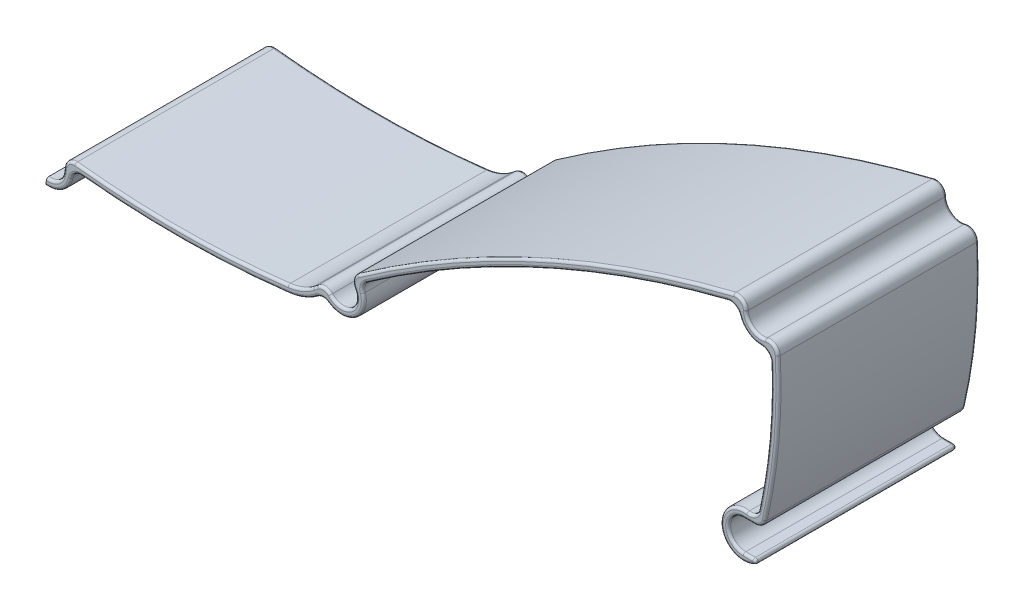
from build123d import *
from build123d.topology import SkipClean

# Parameters (mm, degrees)
EXTRUDE_1_DEPTH     = 40
SKETCH_2_R          = 3
EXTRUDE_1_2_DEPTH   = 40
EXTRUDE_2_DEPTH     = 40
CUT_EXTRUDE_2_DEPTH = 208.592060428
FILLET_1_R          = 2
FILLET_3_R          = 0.5
FILLET_4_R          = 0.5
CUT_EXTRUDE_3_DEPTH = 207.611727306


with BuildPart() as part:
    # ｽｹｯﾁ1 → Extrude 1 (new body)
    with BuildSketch(Plane.XY):
        with BuildLine():
            ThreePointArc((-174.917675812, 6.802025891), (-175.16536545, 24.049389715), (-168.029000204, 39.753058081))
            ThreePointArc((-168.029000204, 39.753058081), (-164.386404751, 43.234236237), (-159.829079223, 45.38316318))
            ThreePointArc((-159.829079223, 45.38316318), (-73.039152779, 60.834071576), (15.071759596, 58.061162838))
            ThreePointArc((15.071759596, 58.061162838), (38.698282136, 56.368912879), (62.348129133, 57.695945012))
            ThreePointArc((62.348129133, 57.695945012), (64.982359088, 58.386614212), (67.332573283, 59.762362967))
            ThreePointArc((67.332573283, 59.762362967), (68.437320119, 60.625078199), (69.547541148, 61.480737248))
            ThreePointArc((69.547541148, 61.480737248), (69.829795591, 61.819116287), (69.939206591, 62.245961901))
            ThreePointArc((69.939206591, 62.245961901), (71.148233251, 64.567309568), (73.719523874, 65.056047728))
            ThreePointArc((73.719523874, 65.056047728), (74.15979094, 65.03780341), (74.565156848, 65.21056459))
            ThreePointArc((74.565156848, 65.21056459), (113.346908434, 87.575280448), (155.853132865, 101.626104486))
            ThreePointArc((155.853132865, 101.626104486), (158.26218824, 101.124572816), (159.485666507, 98.989582711))
            ThreePointArc((159.485666507, 98.989582711), (159.562144442, 78.779630656), (155.859832877, 58.911543179))
            Line((155.859832877, 58.911543179), (154.417522154, 59.323538057))
            ThreePointArc((154.417522154, 59.323538057), (158.068245541, 78.914782698), (157.992833254, 98.843128361))
            ThreePointArc((157.992833254, 98.843128361), (157.38109412, 99.910623413), (156.176566433, 100.161389249))
            ThreePointArc((156.176566433, 100.161389249), (113.960157168, 86.206366284), (75.442826616, 63.994137124))
            ThreePointArc((75.442826616, 63.994137124), (74.429411845, 63.562234175), (73.32874418, 63.607844969))
            ThreePointArc((73.32874418, 63.607844969), (72.043098868, 63.363475889), (71.438585538, 62.202802056))
            ThreePointArc((71.438585538, 62.202802056), (71.165058039, 61.135688021), (70.459421932, 60.289740423))
            ThreePointArc((70.459421932, 60.289740423), (69.356770591, 59.439915413), (68.259556121, 58.583082331))
            ThreePointArc((68.259556121, 58.583082331), (65.556810089, 57.000971383), (62.527445976, 56.206701758))
            ThreePointArc((62.527445976, 56.206701758), (38.68669584, 54.868957627), (14.869458419, 56.574867365))
            ThreePointArc((14.869458419, 56.574867365), (-72.930878607, 59.337984435), (-159.414875998, 43.941485058))
            ThreePointArc((-159.414875998, 43.941485058), (-163.537227688, 41.997749947), (-166.832146939, 38.848877645))
            ThreePointArc((-166.832146939, 38.848877645), (-173.697107608, 23.742438725), (-173.458837906, 7.151012945))
            Line((-173.458837906, 7.151012945), (-174.917675812, 6.802025891))
        make_face()
    extrude(amount=EXTRUDE_1_DEPTH)

    # ｽｹｯﾁ2 → Extrude 1 2 (add, through all)
    with BuildSketch(Plane.XY):
        with Locations((156.5, 98.696674011)):
            Circle(SKETCH_2_R)
        with Locations((152.975211431, 59.735532934)):
            Circle(SKETCH_2_R)
        with Locations((72.937964485, 62.15964221)):
            Circle(SKETCH_2_R)
        with Locations((14.667154113, 55.08857315)):
            Circle(SKETCH_2_R)
        with Locations((-95.332845887, 55.602740192)):
            Circle(SKETCH_2_R)
        with Locations((-159, 42.5)):
            Circle(SKETCH_2_R)
        with Locations((-172, 7.5)):
            Circle(SKETCH_2_R)
    extrude(amount=EXTRUDE_1_2_DEPTH)

    # ｽｹｯﾁ3 → ﾎﾞｽ - 押し出し2 (add, through all)
    with SkipClean():  # the faces are left unmerged after this step: merging them gives an invalid solid
        with BuildSketch(Plane.XY.offset(40)):
            with BuildLine():
                ThreePointArc((155.105149564, 61.848200335), (155.309814131, 62.650779102), (155.508210181, 63.454930376))
                ThreePointArc((155.508210181, 63.454930376), (148.997241196, 57.631785608), (157.475211431, 59.735532934))
                ThreePointArc((157.475211431, 59.735532934), (157.288117426, 61.019605313), (156.742392819, 62.196903362))
                ThreePointArc((156.742392819, 62.196903362), (156.314091206, 60.550736841), (155.859832877, 58.911543179))
                ThreePointArc((155.859832877, 58.911543179), (150.069623581, 58.988834035), (155.105149564, 61.848200335))
            make_face()
            with BuildLine():
                ThreePointArc((156.742392819, 62.196903362), (156.187488729, 62.886925414), (155.508210181, 63.454930376))
                ThreePointArc((155.508210181, 63.454930376), (155.309814131, 62.650779102), (155.105149564, 61.848200335))
                ThreePointArc((155.105149564, 61.848200335), (150.069623581, 58.988834035), (155.859832877, 58.911543179))
                ThreePointArc((155.859832877, 58.911543179), (156.314091206, 60.550736841), (156.742392819, 62.196903362))
            make_face()
            with BuildLine():
                ThreePointArc((153.634250899, 99.584075889), (152.831051821, 99.395038452), (152.028572351, 99.202969162))
                ThreePointArc((152.028572351, 99.202969162), (153.837741702, 95.068674458), (158.324352301, 94.583069912))
                ThreePointArc((158.324352301, 94.583069912), (158.27349835, 95.409770667), (158.216195446, 96.236049458))
                ThreePointArc((158.216195446, 96.236049458), (154.730059706, 96.274420648), (153.634250899, 99.584075889))
            make_face()
            with BuildLine():
                ThreePointArc((70.459421932, 60.289740423), (69.906180844, 59.864751513), (69.354299522, 59.437998327))
                ThreePointArc((69.354299522, 59.437998327), (74.373845341, 57.894874202), (77.437964485, 62.15964221))
                ThreePointArc((77.437964485, 62.15964221), (77.217292333, 63.55153056), (76.576918629, 64.806907354))
                ThreePointArc((76.576918629, 64.806907354), (76.009223863, 64.40142748), (75.442826616, 63.994137124))
                ThreePointArc((75.442826616, 63.994137124), (75.399998918, 63.963913966), (75.356546973, 63.934595379))
                ThreePointArc((75.356546973, 63.934595379), (74.72769572, 59.751974852), (70.541302553, 60.35520003))
                ThreePointArc((70.541302553, 60.35520003), (70.500705388, 60.322041001), (70.459421932, 60.289740423))
            make_face()
            with BuildLine():
                ThreePointArc((12.289483713, 56.91796744), (11.472492469, 57.023256633), (10.655298124, 57.126957688))
                ThreePointArc((10.655298124, 57.126957688), (13.619144559, 50.712310364), (19.167154113, 55.08857315))
                ThreePointArc((19.167154113, 55.08857315), (19.140980955, 55.573210523), (19.062765943, 56.052210345))
                ThreePointArc((19.062765943, 56.052210345), (18.249123765, 56.1461181), (17.435899956, 56.243582438))
                ThreePointArc((17.435899956, 56.243582438), (14.277367269, 52.114003228), (12.289483713, 56.91796744))
            make_face()
            with BuildLine():
                ThreePointArc((-98.102305571, 56.756036796), (-98.918773563, 56.646764089), (-99.735027626, 56.535904666))
                ThreePointArc((-99.735027626, 56.535904666), (-95.801984552, 51.127261568), (-90.832845887, 55.602740192))
                ThreePointArc((-90.832845887, 55.602740192), (-90.951732307, 56.630282793), (-91.302109797, 57.603531678))
                ThreePointArc((-91.302109797, 57.603531678), (-92.120237861, 57.507474522), (-92.938177679, 57.409827398))
                ThreePointArc((-92.938177679, 57.409827398), (-94.956046603, 52.626497208), (-98.102305571, 56.756036796))
            make_face()
            with BuildLine():
                ThreePointArc((-161.968675598, 42.932394718), (-162.736296322, 42.509116787), (-163.47635635, 42.039311575))
                ThreePointArc((-163.47635635, 42.039311575), (-158.769352625, 38.0059148), (-154.5, 42.5))
                ThreePointArc((-154.5, 42.5), (-154.710957632, 43.861659124), (-155.324051364, 45.095650521))
                ThreePointArc((-155.324051364, 45.095650521), (-156.117747866, 44.875181143), (-156.911014356, 44.653169519))
                ThreePointArc((-156.911014356, 44.653169519), (-158.033702901, 39.659882059), (-161.968675598, 42.932394718))
            make_face()
            with BuildLine():
                ThreePointArc((-175.578603832, 10.228295184), (-173.439840747, 3.236567272), (-167.5, 7.5))
                ThreePointArc((-167.5, 7.5), (-169.737135307, 11.389658518), (-174.224197059, 11.411898189))
                ThreePointArc((-174.224197059, 11.411898189), (-174.113884067, 10.579249836), (-173.985166515, 9.74924741))
                ThreePointArc((-173.985166515, 9.74924741), (-169.139756236, 6.595010712), (-174.917675812, 6.802025891))
                ThreePointArc((-174.917675812, 6.802025891), (-175.286049309, 8.50784779), (-175.578603832, 10.228295184))
            make_face()
            with BuildLine():
                ThreePointArc((-173.985166515, 9.74924741), (-174.113884067, 10.579249836), (-174.224197059, 11.411898189))
                ThreePointArc((-174.224197059, 11.411898189), (-174.961140585, 10.888457825), (-175.578603832, 10.228295184))
                ThreePointArc((-175.578603832, 10.228295184), (-175.286049309, 8.50784779), (-174.917675812, 6.802025891))
                ThreePointArc((-174.917675812, 6.802025891), (-169.139756236, 6.595010712), (-173.985166515, 9.74924741))
            make_face()
            with BuildLine():
                ThreePointArc((-174.917675812, 6.802025891), (-169.139756236, 6.595010712), (-173.985166515, 9.74924741))
                ThreePointArc((-173.985166515, 9.74924741), (-173.403193785, 25.035153743), (-166.832146939, 38.848877645))
                ThreePointArc((-166.832146939, 38.848877645), (-164.631459446, 41.165814703), (-161.968675598, 42.932394718))
                ThreePointArc((-161.968675598, 42.932394718), (-158.033702901, 39.659882059), (-156.911014356, 44.653169519))
                ThreePointArc((-156.911014356, 44.653169519), (-127.721253028, 51.747326401), (-98.102305571, 56.756036796))
                ThreePointArc((-98.102305571, 56.756036796), (-94.956046603, 52.626497208), (-92.938177679, 57.409827398))
                ThreePointArc((-92.938177679, 57.409827398), (-40.309022297, 60.442434008), (12.289483713, 56.91796744))
                ThreePointArc((12.289483713, 56.91796744), (14.277367269, 52.114003228), (17.435899956, 56.243582438))
                ThreePointArc((17.435899956, 56.243582438), (39.98055891, 54.863431307), (62.527445397, 56.206701272))
                ThreePointArc((62.527445397, 56.206701272), (65.556809954, 57.000970881), (68.259556248, 58.583082168))
                ThreePointArc((68.259556248, 58.583082168), (69.356770591, 59.439915413), (70.459421932, 60.289740423))
                ThreePointArc((70.459421932, 60.289740423), (70.500705388, 60.322041001), (70.541302553, 60.35520003))
                ThreePointArc((70.541302553, 60.35520003), (74.72769572, 59.751974852), (75.356546973, 63.934595379))
                ThreePointArc((75.356546973, 63.934595379), (75.399998918, 63.963913966), (75.442826616, 63.994137124))
                ThreePointArc((75.442826616, 63.994137124), (112.772142039, 85.669896417), (153.634250899, 99.584075889))
                ThreePointArc((153.634250899, 99.584075889), (154.730059706, 96.274420648), (158.216195446, 96.236049458))
                ThreePointArc((158.216195446, 96.236049458), (158.068245541, 78.914782698), (155.105149564, 61.848200335))
                ThreePointArc((155.105149564, 61.848200335), (150.069623581, 58.988834035), (155.859832877, 58.911543179))
                ThreePointArc((155.859832877, 58.911543179), (159.562144442, 78.779630656), (159.485666507, 98.989582711))
                ThreePointArc((159.485666507, 98.989582711), (158.26218824, 101.124572816), (155.853132865, 101.626104486))
                ThreePointArc((155.853132865, 101.626104486), (113.346908434, 87.575280448), (74.565156848, 65.21056459))
                ThreePointArc((74.565156848, 65.21056459), (74.15979094, 65.03780341), (73.719523874, 65.056047728))
                ThreePointArc((73.719523874, 65.056047728), (71.148233251, 64.567309568), (69.939206591, 62.245961901))
                ThreePointArc((69.939206591, 62.245961901), (69.829795591, 61.819116287), (69.547541148, 61.480737248))
                ThreePointArc((69.547541148, 61.480737248), (68.437320119, 60.625078199), (67.332573283, 59.762362967))
                ThreePointArc((67.332573283, 59.762362967), (64.982359088, 58.386614212), (62.348129133, 57.695945012))
                ThreePointArc((62.348129133, 57.695945012), (38.698282167, 56.368913497), (15.07175968, 58.061163451))
                ThreePointArc((15.07175968, 58.061163451), (-73.039152866, 60.83407219), (-159.829079451, 45.383163973))
                ThreePointArc((-159.829079451, 45.383163973), (-164.386405219, 43.234236917), (-168.029000204, 39.753058081))
                ThreePointArc((-168.029000204, 39.753058081), (-175.16536545, 24.049389715), (-174.917675812, 6.802025891))
            make_face()
        extrude(amount=-EXTRUDE_2_DEPTH)
    add(part.part.scale(1), mode=Mode.REPLACE)  # the faces are merged on a copy

    # ｽｹｯﾁ4 → ｶｯﾄ - 押し出し2 (cut, through all)
    with BuildSketch(Plane.XY.offset(40)):
        with BuildLine():
            Line((-161.881126724, 41.663872737), (-162.717256801, 44.545009155))
            ThreePointArc((-162.717256801, 44.545009155), (-160.67225734, 48.262263142), (-156.955003353, 46.217263682))
            Line((-156.955003353, 46.217263682), (-156.118873276, 43.336127263))
            ThreePointArc((-156.118873276, 43.336127263), (-158.163872737, 39.618873276), (-161.881126724, 41.663872737))
        make_face()
        with BuildLine():
            Line((-172, 4.5), (-176.5, 4.5))
            ThreePointArc((-176.5, 4.5), (-179.5, 7.5), (-176.5, 10.5))
            Line((-176.5, 10.5), (-172, 10.5))
            ThreePointArc((-172, 10.5), (-169, 7.5), (-172, 4.5))
        make_face()
        with BuildLine():
            Line((-98.309088871, 55.225940908), (-98.685888052, 58.202183073))
            ThreePointArc((-98.685888052, 58.202183073), (-96.086444352, 61.555225341), (-92.733402084, 58.955781642))
            Line((-92.733402084, 58.955781642), (-92.356602903, 55.979539476))
            ThreePointArc((-92.356602903, 55.979539476), (-94.956046603, 52.626497208), (-98.309088871, 55.225940908))
        make_face()
        with BuildLine():
            Line((11.694563608, 55.493178744), (12.099169116, 58.465768619))
            ThreePointArc((12.099169116, 58.465768619), (15.476365216, 61.03375353), (18.044350127, 57.65655743))
            Line((18.044350127, 57.65655743), (17.639744618, 54.683967555))
            ThreePointArc((17.639744618, 54.683967555), (14.262548518, 52.115982644), (11.694563608, 55.493178744))
        make_face()
        with BuildLine():
            Line((70.530297127, 60.369910976), (68.740565893, 62.777578334))
            ThreePointArc((68.740565893, 62.777578334), (69.358502016, 66.974976927), (73.555900609, 66.357040803))
            Line((73.555900609, 66.357040803), (75.345631843, 63.949373445))
            ThreePointArc((75.345631843, 63.949373445), (74.72769572, 59.751974852), (70.530297127, 60.369910976))
        make_face()
        with BuildLine():
            Line((154.072101195, 100.458862251), (155.834289436, 102.886761056))
            ThreePointArc((155.834289436, 102.886761056), (160.024376481, 103.55247162), (160.690087045, 99.362384575))
            Line((160.690087045, 99.362384575), (158.927898805, 96.934485771))
            ThreePointArc((158.927898805, 96.934485771), (154.73781176, 96.268775206), (154.072101195, 100.458862251))
        make_face()
        with BuildLine():
            Line((152.975211431, 62.735532934), (157.475211431, 62.735532934))
            ThreePointArc((157.475211431, 62.735532934), (160.475211431, 59.735532934), (157.475211431, 56.735532934))
            Line((157.475211431, 56.735532934), (152.975211431, 56.735532934))
            ThreePointArc((152.975211431, 56.735532934), (149.975211431, 59.735532934), (152.975211431, 62.735532934))
        make_face()
    extrude(amount=-CUT_EXTRUDE_2_DEPTH, mode=Mode.SUBTRACT)

    # ﾌｨﾚｯﾄ1
    fillet_1_edges = [part.edges().sort_by_distance(p)[0] for p in [
        (-174.224197059, 11.411898189, 20),
        (-155.324051364, 45.095650521, 20),
        (-99.735027626, 56.535904666, 20),
        (-91.302109797, 57.603531678, 20),
        (10.655298124, 57.126957688, 20),
        (19.062765943, 56.052210345, 20),
        (69.354299522, 59.437998327, 20),
        (76.576918629, 64.806907354, 20),
        (152.028572351, 99.202969162, 20),
        (158.324352301, 94.583069912, 20),
        (155.508210181, 63.454930376, 20),
        (156.876524055, 62.735532934, 20),
        (159.591463431, 97.848728486, 20),
        (154.738438299, 101.376924818, 20),
        (74.458181594, 65.14323147, 20),
        (69.642846878, 61.563769001, 20),
        (18.047519346, 57.680566039, 20),
        (12.0977422, 58.455285231, 20),
        (-92.732073243, 58.945285465, 20),
        (-98.684559207, 58.191686864, 20),
        (-156.950021623, 46.200097642, 20),
        (-162.638748681, 44.274485931, 20),
        (-175.617677363, 10.5, 20),
        (-163.47635635, 42.039311575, 20),
    ]]
    fillet(fillet_1_edges, radius=FILLET_1_R)

    # ﾌｨﾚｯﾄ3
    fillet_3_edges = [part.edges().sort_by_distance(p)[0] for p in [
        (-175.354101966, 4.5, 20),
        (156.329313397, 56.735532934, 20),
    ]]
    fillet(fillet_3_edges, radius=FILLET_3_R)

    # ﾌｨﾚｯﾄ4
    fillet_4_edges = [part.edges().sort_by_distance(p)[0] for p in [
        (-172.852772551, 27.036503028, 40),
        (-172.852772551, 27.036503028, 0),
        (-174.496755599, 26.76353818, 40),
        (64.982359088, 58.386614212, 40),
        (41.171934255, 56.366268849, 40),
        (37.32663542, 54.884402397, 40),
        (-156.25241115, 43.796271973, 40),
        (-158.163872737, 39.618873276, 40),
        (-156.25241115, 43.796271973, 0),
        (-158.163872737, 39.618873276, 0),
        (-172.919038538, 10.5, 0),
        (-172.919038538, 10.5, 40),
        (-169, 7.5, 40),
        (-169, 7.5, 0),
        (-92.4175483, 56.460931868, 40),
        (-94.956046603, 52.626497208, 40),
        (-92.4175483, 56.460931868, 0),
        (-94.956046603, 52.626497208, 0),
        (14.262548518, 52.115982644, 40),
        (17.711667491, 55.212376579, 40),
        (14.262548518, 52.115982644, 0),
        (17.711667491, 55.212376579, 0),
        (149.975211431, 59.735532934, 40),
        (153.943457268, 56.735532934, 40),
        (149.975211431, 59.735532934, 0),
        (153.943457268, 56.735532934, 0),
        (-157.222222844, 38.366054139, 40),
        (-157.222222844, 38.366054139, 0),
        (-127.7212524, 51.747326519, 0),
        (-127.7212524, 51.747326519, 40),
        (-94.85985575, 51.127666971, 40),
        (-94.85985575, 51.127666971, 0),
        (-40.309022297, 60.442434008, 0),
        (-40.309022297, 60.442434008, 40),
        (14.115637874, 50.62249771, 40),
        (14.115637874, 50.62249771, 0),
        (65.429568152, 56.949108434, 40),
        (65.429568152, 56.949108434, 0),
        (75.621371199, 58.547256792, 40),
        (75.621371199, 58.547256792, 0),
        (112.400183249, 85.500173809, 0),
        (112.400183249, 85.500173809, 40),
        (153.827551561, 95.076174137, 40),
        (153.827551561, 95.076174137, 0),
        (158.068245541, 78.914782698, 0),
        (158.068245541, 78.914782698, 40),
        (148.538237858, 58.985022768, 40),
        (148.538237858, 58.985022768, 0),
        (159.585920071, 79.046123951, 0),
        (159.585920071, 79.046123951, 40),
        (-166.634814433, 41.359610926, 0),
        (-161.890971039, 41.697794272, 0),
        (-128.024778685, 53.216297373, 0),
        (-98.370034264, 55.707333273, 0),
        (-40.302010998, 61.942418726, 0),
        (11.760006542, 55.973980411, 0),
        (67.692381882, 60.044588841, 0),
        (74.72769572, 59.751974852, 0),
        (111.949802025, 86.943547277, 0),
        (154.723182233, 96.279461024, 0),
        (154.13630839, 62.735532934, 0),
        (-166.307123073, 39.502792681, 0),
        (-175.18499823, 11.021553718, 0),
        (-163.196649172, 43.074160345, 0),
        (-156.21061286, 45.790321687, 0),
        (-99.199108533, 57.525374806, 0),
        (-92.067706458, 58.428226942, 0),
        (11.428570831, 57.944459992, 0),
        (18.533672833, 57.046818746, 0),
        (69.440025994, 60.742330955, 0),
        (75.303219572, 65.100715699, 0),
        (152.715168975, 100.150386551, 0),
        (159.026732407, 95.51117627, 0),
        (156.542606194, 63.17045311, 0),
        (154.13630839, 62.735532934, 40),
        (-166.307123073, 39.502792681, 40),
        (154.723182233, 96.279461024, 40),
        (111.949802025, 86.943547277, 40),
        (74.72769572, 59.751974852, 40),
        (67.692381882, 60.044588841, 40),
        (11.760006542, 55.973980411, 40),
        (-40.302010998, 61.942418726, 40),
        (-98.370034264, 55.707333273, 40),
        (-128.024778685, 53.216297373, 40),
        (-161.890971039, 41.697794272, 40),
        (-166.634814433, 41.359610926, 40),
        (-175.18499823, 11.021553718, 40),
        (-163.196649172, 43.074160345, 40),
        (-156.21061286, 45.790321687, 40),
        (-99.199108533, 57.525374806, 40),
        (-92.067706458, 58.428226942, 40),
        (11.428570831, 57.944459992, 40),
        (18.533672833, 57.046818746, 40),
        (69.440025994, 60.742330955, 40),
        (75.303219572, 65.100715699, 40),
        (152.715168975, 100.150386551, 40),
        (159.026732407, 95.51117627, 40),
        (156.542606194, 63.17045311, 40),
        (-173.768568414, 12.485677184, 40),
        (-173.768568414, 12.485677184, 0),
        (-154.322969262, 44.816153309, 40),
        (-154.322969262, 44.816153309, 0),
        (-100.544388476, 55.883817911, 40),
        (-100.544388476, 55.883817911, 0),
        (-90.355778022, 57.17371948, 40),
        (-90.355778022, 57.17371948, 0),
        (9.704989693, 56.706010853, 40),
        (9.704989693, 56.706010853, 0),
        (19.853694224, 55.435635153, 40),
        (19.853694224, 55.435635153, 0),
        (69.202538318, 58.814048447, 40),
        (69.202538318, 58.814048447, 0),
        (77.227575415, 64.793075978, 40),
        (77.227575415, 64.793075978, 0),
        (151.279758761, 98.466578224, 40),
        (64.982359088, 58.386614212, 0),
        (151.279758761, 98.466578224, 0),
        (157.829689409, 93.629137307, 40),
        (157.829689409, 93.629137307, 0),
        (155.19278095, 64.482151477, 40),
        (155.19278095, 64.482151477, 0),
        (-164.153767397, 40.733981209, 40),
        (-164.153767397, 40.733981209, 0),
        (-174.496755599, 26.76353818, 0),
        (41.171934255, 56.366268849, 0),
        (-169.714555743, 3.623565485, 0),
        (-172.968245837, 4.5, 0),
        (-174.420614591, 4.125, 0),
        (155.395826022, 56.360532934, 0),
        (-172.968245837, 4.5, 40),
        (-169.714555743, 3.623565485, 40),
        (-174.420614591, 4.125, 40),
        (155.395826022, 56.360532934, 40),
        (37.32663542, 54.884402397, 0),
    ]]
    fillet(fillet_4_edges, radius=FILLET_4_R)

    # ｽｹｯﾁ5 → ｶｯﾄ - 押し出し3 (cut, through all)
    with BuildSketch(Plane(origin=(0, 0, 0), x_dir=(-1, 0, 0), z_dir=(0, 0, -1))):
        with BuildLine():
            Line((-14.115638044, 50.622497688), (-14.667154113, 55.08857315))
            Line((-14.667154113, 55.08857315), (-15.690627539, 63.37647229))
            add(Edge.make_bspline(
                [(-15.690627539, 63.37647229), (-17.334617898, 69.982526963), (-21.972204895, 88.617765969), (39.59099728, 88.131563488), (82.896808446, 66.274983812), (138.630742778, 56.604630711), (180.262909463, 55.367215325), (199.246708061, 19.576547293), (172.250528497, -42.660651844), (85.864873433, 1.702480232), (21.148757399, 14.194306458), (-6.451973954, 42.70591731), (-14.115638044, 50.622497688)],
                knots=[0, 0, 0, 0, 0.035176098, 0.099229424, 0.264860169, 0.374719133, 0.434579012, 0.499387156, 0.583698261, 0.765783496, 0.934967064, 1, 1, 1, 1], degree=3))
        make_face()
    extrude(amount=-CUT_EXTRUDE_3_DEPTH, mode=Mode.SUBTRACT)


solid = part.part
